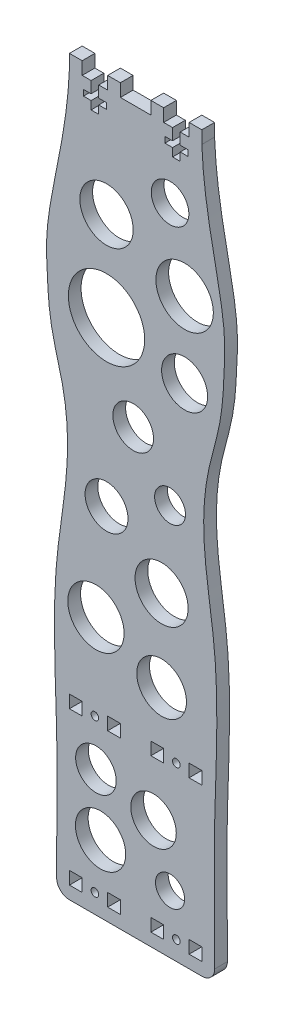
from build123d import *

# Parameters (mm, degrees)
BOSS_EXTRU_1_OUTLINE_W  = 5
BOSS_EXTRU_1_OUTLINE_H  = 5
BOSS_EXTRU_1_OUTLINE_R  = 1.5
BOSS_EXTRU_1_DEPTH      = 5
CONG_1_R                = 5
ESQUISSE2_R             = 10.479020463
ESQUISSE2_R_2           = 11.286250442
ESQUISSE2_R_3           = 14.998606228
ESQUISSE2_R_4           = 9.04246197
ESQUISSE2_R_5           = 7.987110618
ESQUISSE2_R_6           = 8.435448753
ESQUISSE2_R_7           = 10.430543624
ESQUISSE2_R_8           = 11.053332103
ESQUISSE2_R_9           = 9.762822846
ESQUISSE2_R_10          = 7.974231095
ESQUISSE2_R_11          = 8.937052564
ESQUISSE2_R_12          = 9.881615002
ESQUISSE2_R_13          = 5.718955096
ESQUISSE2_R_14          = 6.068652319
ESQUISSE2_R_15          = 7.38923853
ENL_V_MAT_EXTRU_1_DEPTH = 291.112887432


# Read off the part's stored shape, not the designer's step: Boss.-Extru.1
with BuildPart() as part:
    # Boss.-Extru.1 outline → Boss.-Extru.1 (new body)
    with BuildSketch(Plane.XY):
        with BuildLine():
            Line((-11, 282.95), (-14.5, 282.95))
            Line((-14.5, 282.95), (-14.5, 278.45))
            Line((-14.5, 278.45), (-11.5, 278.45))
            Line((-11.5, 278.45), (-11.5, 276.15))
            Line((-11.5, 276.15), (-14.5, 276.15))
            Line((-14.5, 276.15), (-14.5, 272.95))
            Line((-14.5, 272.95), (-17.5, 272.95))
            Line((-17.5, 272.95), (-17.5, 276.15))
            Line((-17.5, 276.15), (-20.5, 276.15))
            Line((-20.5, 276.15), (-20.5, 278.45))
            Line((-20.5, 278.45), (-17.5, 278.45))
            Line((-17.5, 278.45), (-17.5, 282.95))
            Line((-17.5, 282.95), (-21, 282.95))
            Line((-21, 282.95), (-21, 287.95))
            Line((-21, 287.95), (-26, 287.95))
            Line((-26, 287.95), (-26, 282.95))
            add(Edge.make_bspline(
                [(-26, 282.95), (-27.032116552, 257.046555191), (-35.745054738, 233.213160009), (-34.467552531, 202.327968058), (-33.835737582, 192.481171289), (-22.802824593, 154.820919245), (-34.333596657, 115.729935588), (-30.079746619, 52.424101474), (-31.204515071, 22.445349412), (-31, 0)],
                knots=[0, 0, 0, 0, 0.136549551, 0.164120468, 0.263310424, 0.303233361, 0.550951087, 0.789366994, 1, 1, 1, 1], degree=3))
            Line((-31, 0), (31, 0))
            add(Edge.make_bspline(
                [(26, 282.95), (27.032116552, 257.046555191), (35.745054738, 233.213160009), (34.467552531, 202.327968058), (33.835737582, 192.481171289), (22.802824593, 154.820919245), (34.333596657, 115.729935588), (30.079746619, 52.424101474), (31.204515071, 22.445349412), (31, 0)],
                knots=[0, 0, 0, 0, 0.136549551, 0.164120468, 0.263310424, 0.303233361, 0.550951087, 0.789366994, 1, 1, 1, 1], degree=3))
            Line((26, 282.95), (26, 287.95))
            Line((26, 287.95), (21, 287.95))
            Line((21, 287.95), (21, 282.95))
            Line((21, 282.95), (17.5, 282.95))
            Line((17.5, 282.95), (17.5, 278.45))
            Line((17.5, 278.45), (20.5, 278.45))
            Line((20.5, 278.45), (20.5, 276.15))
            Line((20.5, 276.15), (17.5, 276.15))
            Line((17.5, 276.15), (17.5, 272.95))
            Line((17.5, 272.95), (14.5, 272.95))
            Line((14.5, 272.95), (14.5, 276.15))
            Line((14.5, 276.15), (11.5, 276.15))
            Line((11.5, 276.15), (11.5, 278.45))
            Line((11.5, 278.45), (14.5, 278.45))
            Line((14.5, 278.45), (14.5, 282.95))
            Line((14.5, 282.95), (11, 282.95))
            Line((11, 282.95), (11, 287.95))
            Line((11, 287.95), (6, 287.95))
            Line((6, 287.95), (6, 282.95))
            Line((6, 282.95), (-6, 282.95))
            Line((-6, 282.95), (-6, 287.95))
            Line((-6, 287.95), (-11, 287.95))
            Line((-11, 287.95), (-11, 282.95))
        make_face()
        with Locations((-23.5, 7.5)):
            Rectangle(BOSS_EXTRU_1_OUTLINE_W, BOSS_EXTRU_1_OUTLINE_H, mode=Mode.SUBTRACT)
        with Locations((-23.5, 67.5)):
            Rectangle(BOSS_EXTRU_1_OUTLINE_W, BOSS_EXTRU_1_OUTLINE_H, mode=Mode.SUBTRACT)
        with Locations((-16, 7.5)):
            Circle(BOSS_EXTRU_1_OUTLINE_R, mode=Mode.SUBTRACT)
        with Locations((-8.5, 7.5)):
            Rectangle(BOSS_EXTRU_1_OUTLINE_W, BOSS_EXTRU_1_OUTLINE_H, mode=Mode.SUBTRACT)
        with Locations((-16, 67.5)):
            Circle(BOSS_EXTRU_1_OUTLINE_R, mode=Mode.SUBTRACT)
        with Locations((-8.5, 67.5)):
            Rectangle(BOSS_EXTRU_1_OUTLINE_W, BOSS_EXTRU_1_OUTLINE_H, mode=Mode.SUBTRACT)
        with Locations((8.5, 7.5)):
            Rectangle(BOSS_EXTRU_1_OUTLINE_W, BOSS_EXTRU_1_OUTLINE_H, mode=Mode.SUBTRACT)
        with Locations((16, 7.5)):
            Circle(BOSS_EXTRU_1_OUTLINE_R, mode=Mode.SUBTRACT)
        with Locations((8.5, 67.5)):
            Rectangle(BOSS_EXTRU_1_OUTLINE_W, BOSS_EXTRU_1_OUTLINE_H, mode=Mode.SUBTRACT)
        with Locations((16, 67.5)):
            Circle(BOSS_EXTRU_1_OUTLINE_R, mode=Mode.SUBTRACT)
        with Locations((23.5, 7.5)):
            Rectangle(BOSS_EXTRU_1_OUTLINE_W, BOSS_EXTRU_1_OUTLINE_H, mode=Mode.SUBTRACT)
        with Locations((23.5, 67.5)):
            Rectangle(BOSS_EXTRU_1_OUTLINE_W, BOSS_EXTRU_1_OUTLINE_H, mode=Mode.SUBTRACT)
    extrude(amount=BOSS_EXTRU_1_DEPTH)

    # Congé1
    cong_1_edges = [part.edges().sort_by_distance(p)[0] for p in [
        (31, 0, 2.5),
        (-31, 0, 2.5),
    ]]
    fillet(cong_1_edges, radius=CONG_1_R)

    # Esquisse2 → Enlèv. mat.-Extru.1 (cut, through all)
    with BuildSketch(Plane.XY.offset(5)):
        with Locations((-11.437910192, 240.417379121)):
            Circle(ESQUISSE2_R)
        with Locations((19.236485323, 227.939658911)):
            Circle(ESQUISSE2_R_2)
        with Locations((-11.437910192, 205.323791031)):
            Circle(ESQUISSE2_R_3)
        with Locations((19.236485323, 198.305073413)):
            Circle(ESQUISSE2_R_4)
        with Locations((-0.95888973, 173.349632994)):
            Circle(ESQUISSE2_R_5)
        with Locations((-11.437910192, 141.115522452)):
            Circle(ESQUISSE2_R_6)
        with Locations((10.194023353, 122.398942137)):
            Circle(ESQUISSE2_R_7)
        with Locations((-15.597150262, 101.342789283)):
            Circle(ESQUISSE2_R_8)
        with Locations((10.194023353, 90.28945718)):
            Circle(ESQUISSE2_R_9)
        with Locations((-15.597150262, 49.612240914)):
            Circle(ESQUISSE2_R_10)
        with Locations((7.028220888, 43.633333313)):
            Circle(ESQUISSE2_R_11)
        with Locations((-13.777482732, 26.476468025)):
            Circle(ESQUISSE2_R_12)
        with Locations((13.517530227, 22.837132964)):
            Circle(ESQUISSE2_R_13)
        with Locations((13.517530227, 153.853195166)):
            Circle(ESQUISSE2_R_14)
        with Locations((13.517530227, 256.794386897)):
            Circle(ESQUISSE2_R_15)
    extrude(amount=-ENL_V_MAT_EXTRU_1_DEPTH, mode=Mode.SUBTRACT)


solid = part.part
